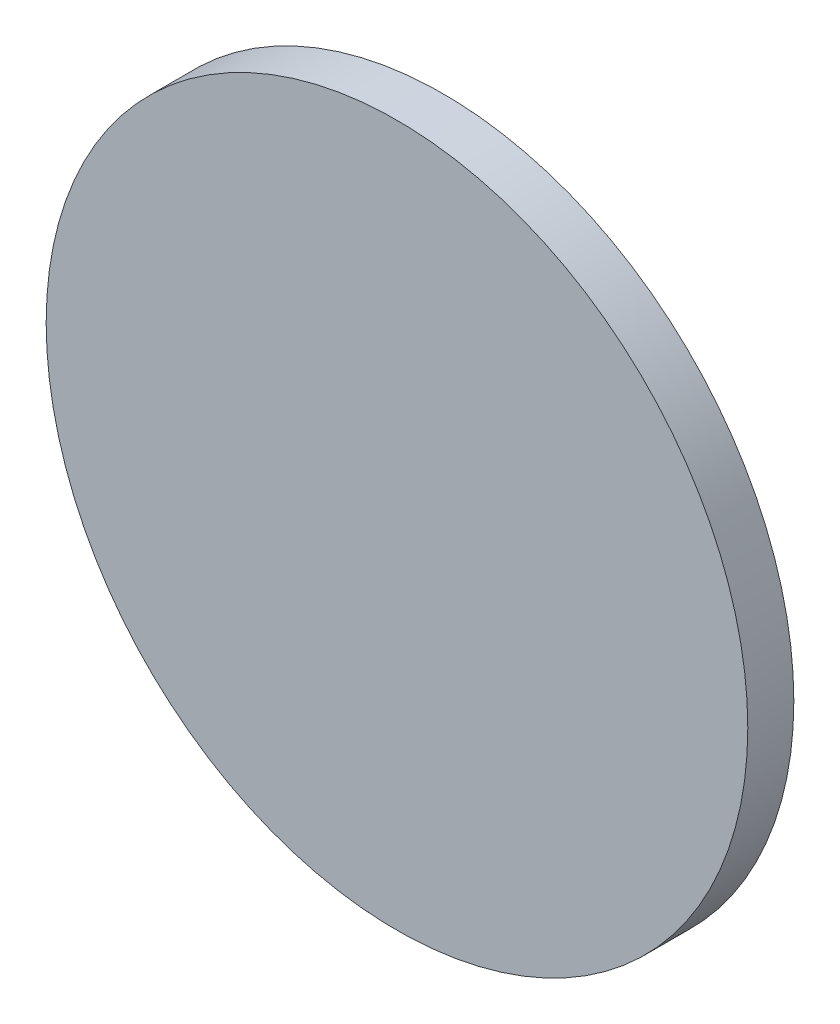
from build123d import *

# Parameters (mm, degrees)
SKETCH1_R           = 76.2
BOSS_EXTRUDE1_DEPTH = 5


with BuildPart() as part:
    # Sketch1 → Boss-Extrude1 (new, symmetric)
    with BuildSketch(Plane.XY):
        Circle(SKETCH1_R)
    extrude(amount=BOSS_EXTRUDE1_DEPTH, both=True)


solid = part.part
